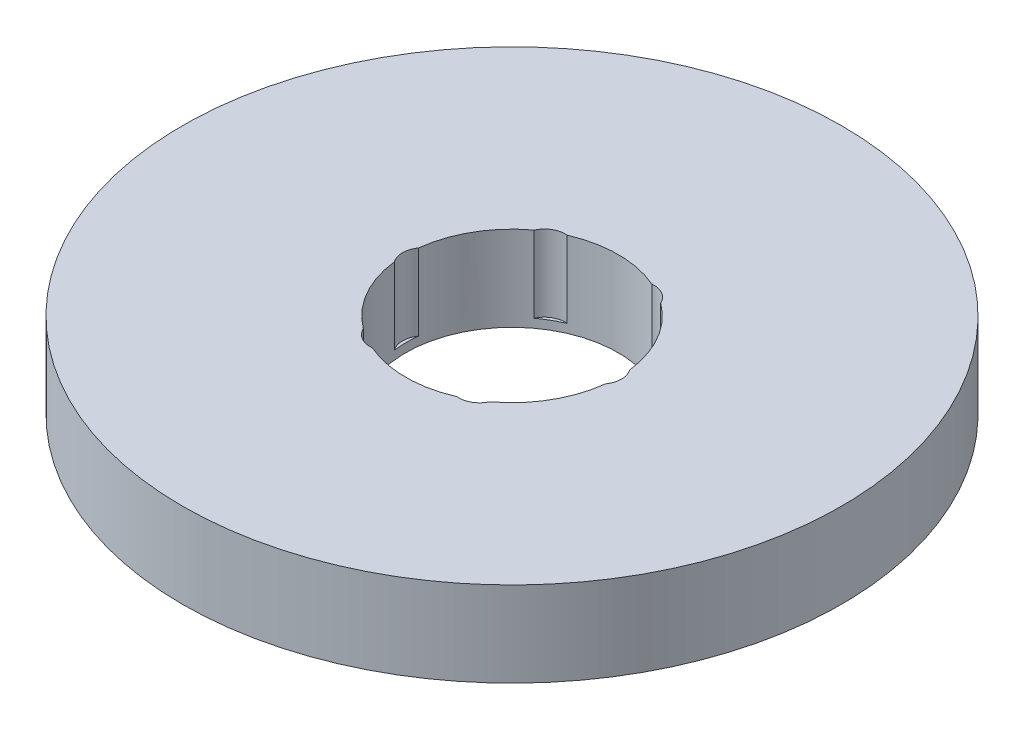
from build123d import *

# Parameters (mm, degrees)
SKETCH1_R           = 77.5
BOSS_EXTRUDE1_DEPTH = 20
SKETCH2_R           = 25
CUT_EXTRUDE1_DEPTH  = 112.411399776
SKETCH3_R           = 4.913720214
CUT_EXTRUDE2_DEPTH  = 17.96338487
CIRPATTERN1_COUNT   = 6


with BuildPart() as part:
    # Sketch1 → Boss-Extrude1 (new body)
    with BuildSketch(Plane(origin=(0, 0, 0), x_dir=(1, 0, 0), z_dir=(0, 1, 0))):
        Circle(SKETCH1_R)
    extrude(amount=BOSS_EXTRUDE1_DEPTH)

    # Sketch2 → Cut-Extrude1 (cut, through all)
    with BuildSketch(Plane(origin=(0, 0, 0), x_dir=(1, 0, 0), z_dir=(0, 1, 0))):
        Circle(SKETCH2_R)
    extrude(amount=CUT_EXTRUDE1_DEPTH, mode=Mode.SUBTRACT)

    # Sketch3 → Cut-Extrude2 (cut)
    with BuildSketch(Plane(origin=(0, 20, 0), x_dir=(1, 0, 0), z_dir=(0, 1, 0))):
        with Locations((-20.8324043, 0)):
            Circle(SKETCH3_R)
    cut_extrude2 = extrude(amount=-CUT_EXTRUDE2_DEPTH, mode=Mode.SUBTRACT)

    # CirPattern1: Cut-Extrude2 ×6 about axis
    cirpattern1_axis = Axis((0, 0, 0), (0, 1, 0))
    for i in range(1, CIRPATTERN1_COUNT):
        add(cut_extrude2.rotate(cirpattern1_axis, i * 360 / CIRPATTERN1_COUNT), mode=Mode.SUBTRACT)


solid = part.part
